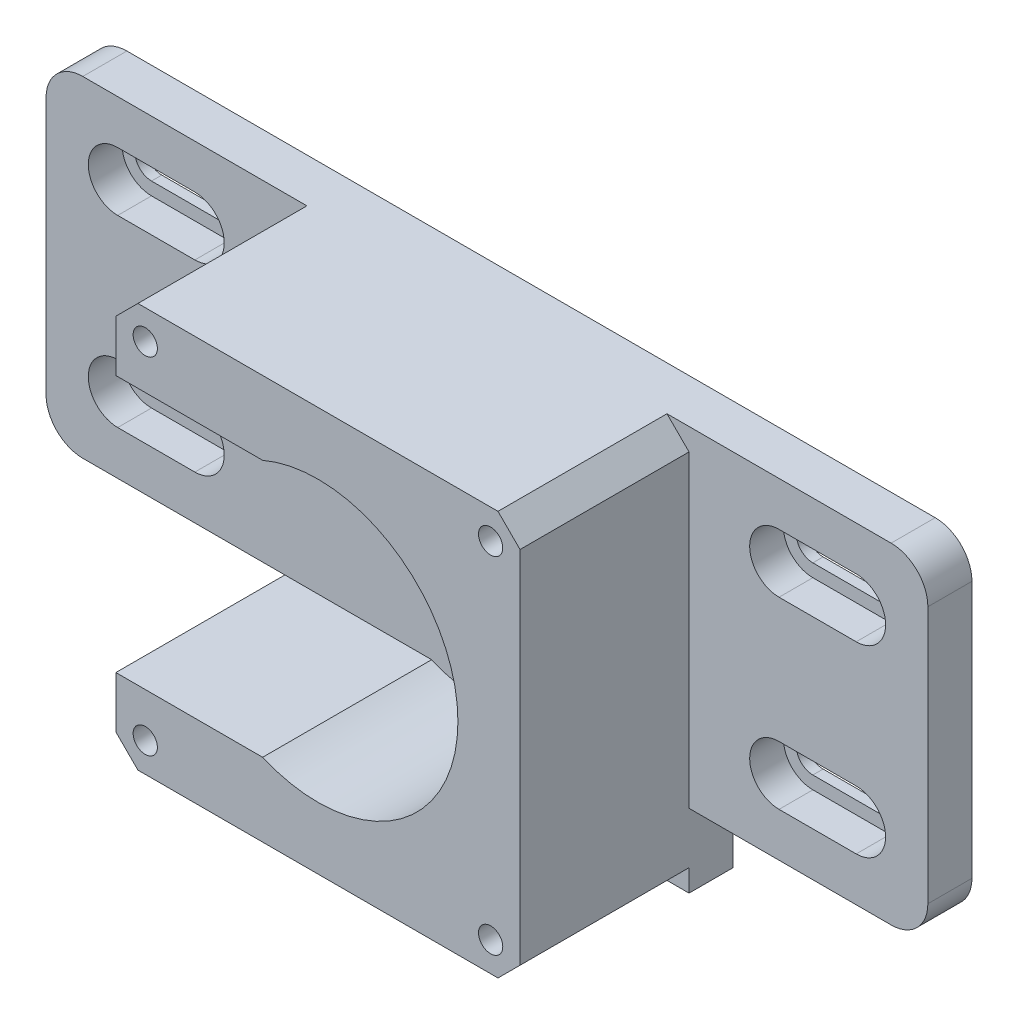
from build123d import *

# Parameters (mm, degrees)
SKETCH_1_W             = 55
SKETCH_1_H             = 55
EXTRUDE_1_DEPTH        = 14.5
SKETCH_2_R             = 19.05
CUT_EXTRUDE_1_DEPTH    = 49.512884886
SKETCH_3_W             = 40
SKETCH_3_H             = 35
CUT_EXTRUDE_2_DEPTH    = 32
CHAMFER_1_SIZE         = 3
HOLE_WIZARD_M4_1_D     = 3.3
HOLE_WIZARD_M4_1_DEPTH = 18.5
HOLE_WIZARD_M4_1_TIP   = 0.991420021
HOLE_WIZARD_M4_2_D     = 3.3
HOLE_WIZARD_M4_2_DEPTH = 18.5
HOLE_WIZARD_M4_2_TIP   = 0.991420021
SKETCH_13_W            = 120
SKETCH_13_H            = 55
EXTRUDE_2_DEPTH        = 6
SKETCH_14_W            = 32.5
SKETCH_14_H            = 10
CUT_EXTRUDE_3_DEPTH    = 10
HOLE_START             = -13.1
HOLE_WIZARD_1_DEPTH    = 4.6
HOLE_START_2           = -14.5
HOLE_WIZARD_1_2_DEPTH  = 1.4
FILLET_2_R             = 5


# Read off the part's stored shape, not the designer's step: 打孔尺寸(%根据)内六角圆柱头螺钉的类型1
with BuildPart() as part:
    # 草图1 → 凸台-拉伸1 (new, symmetric)
    with BuildSketch(Plane.XY):
        Rectangle(SKETCH_1_W, SKETCH_1_H)
    extrude(amount=EXTRUDE_1_DEPTH, both=True)

    # 草图2 → 切除-拉伸1 (cut, through all)
    with BuildSketch(Plane(origin=(0, 0, -14.5), x_dir=(-1, 0, 0), z_dir=(0, 0, -1))):
        Circle(SKETCH_2_R)
    extrude(amount=-CUT_EXTRUDE_1_DEPTH, mode=Mode.SUBTRACT)

    # 草图3 → 切除-拉伸2 (cut)
    with BuildSketch(Plane(origin=(-27.5, 0, 0), x_dir=(0, 0, -1), z_dir=(1, 0, 0))):
        Rectangle(SKETCH_3_W, SKETCH_3_H)
    extrude(amount=CUT_EXTRUDE_2_DEPTH, mode=Mode.SUBTRACT)

    # 倒角1
    chamfer_1_edges = [part.edges().sort_by_distance(p)[0] for p in [
        (27.5, -27.5, 0),
        (-27.5, -27.5, 0),
        (-27.5, 27.5, 0),
        (27.5, 27.5, 0),
    ]]
    chamfer(chamfer_1_edges, length=CHAMFER_1_SIZE)

    # M4 螺纹孔1
    with Locations(Plane(origin=(0, 0, -14.5), x_dir=(-1, 0, 0), z_dir=(0, 0, -1))):
        with Locations((-23.5, 23.5), (23.5, 23.5), (23.5, -23.5), (-23.5, -23.5)):
            Hole(HOLE_WIZARD_M4_1_D / 2, depth=HOLE_WIZARD_M4_1_DEPTH)
            with Locations((0, 0, -(HOLE_WIZARD_M4_1_DEPTH + HOLE_WIZARD_M4_1_TIP / 2))):  # 118° drill point
                Cone(0, HOLE_WIZARD_M4_1_D / 2, HOLE_WIZARD_M4_1_TIP, mode=Mode.SUBTRACT)

    # M4 螺纹孔2
    with Locations(Plane.XY.offset(14.5)):
        with Locations((23.5, 23.5), (-23.5, 23.5), (-23.5, -23.5), (23.5, -23.5)):
            Hole(HOLE_WIZARD_M4_2_D / 2, depth=HOLE_WIZARD_M4_2_DEPTH)
            with Locations((0, 0, -(HOLE_WIZARD_M4_2_DEPTH + HOLE_WIZARD_M4_2_TIP / 2))):  # 118° drill point
                Cone(0, HOLE_WIZARD_M4_2_D / 2, HOLE_WIZARD_M4_2_TIP, mode=Mode.SUBTRACT)

    # 草图13 → 凸台-拉伸2 (add)
    with BuildSketch(Plane(origin=(0, 0, -14.5), x_dir=(-1, 0, 0), z_dir=(0, 0, -1))):
        Rectangle(SKETCH_13_W, SKETCH_13_H)
    extrude(amount=-EXTRUDE_2_DEPTH)

    # 草图14 → 切除-拉伸3 (cut)
    with BuildSketch(Plane.XY.offset(-8.5)):
        with Locations((-43.75, -22.5)):
            Rectangle(SKETCH_14_W, SKETCH_14_H)
        with Locations((43.75, -22.5)):
            Rectangle(SKETCH_14_W, SKETCH_14_H)
    extrude(amount=-CUT_EXTRUDE_3_DEPTH, mode=Mode.SUBTRACT)

    # 打孔尺寸(%根据)内六角圆柱头螺钉的类型1 outline → 打孔尺寸(%根据)内六角圆柱头螺钉的类型1 (cut)
    with BuildSketch(Plane.XY.offset(HOLE_START)):
        with BuildLine():
            Line((39.75, -11.5), (50.25, -11.5))
            ThreePointArc((50.25, -11.5), (54.25, -7.5), (50.25, -3.5))
            Line((50.25, -3.5), (39.75, -3.5))
            ThreePointArc((39.75, -3.5), (35.75, -7.5), (39.75, -11.5))
        make_face()
        with BuildLine():
            ThreePointArc((-39.75, -11.5), (-35.75, -7.5), (-39.75, -3.5))
            Line((-39.75, -3.5), (-50.25, -3.5))
            ThreePointArc((-50.25, -3.5), (-54.25, -7.5), (-50.25, -11.5))
            Line((-50.25, -11.5), (-39.75, -11.5))
        make_face()
        with BuildLine():
            Line((39.75, 13.5), (50.25, 13.5))
            ThreePointArc((50.25, 13.5), (54.25, 17.5), (50.25, 21.5))
            Line((50.25, 21.5), (39.75, 21.5))
            ThreePointArc((39.75, 21.5), (35.75, 17.5), (39.75, 13.5))
        make_face()
        with BuildLine():
            ThreePointArc((-39.75, 13.5), (-35.75, 17.5), (-39.75, 21.5))
            Line((-39.75, 21.5), (-50.25, 21.5))
            ThreePointArc((-50.25, 21.5), (-54.25, 17.5), (-50.25, 13.5))
            Line((-50.25, 13.5), (-39.75, 13.5))
        make_face()
    extrude(amount=HOLE_WIZARD_1_DEPTH, mode=Mode.SUBTRACT)

    # Hole Wizard 1 2 outline → Hole Wizard 1 2 (cut)
    with BuildSketch(Plane.XY.offset(HOLE_START_2)):
        with BuildLine():
            Line((39.75, -9.75), (50.25, -9.75))
            ThreePointArc((50.25, -9.75), (52.5, -7.5), (50.25, -5.25))
            Line((50.25, -5.25), (39.75, -5.25))
            ThreePointArc((39.75, -5.25), (37.5, -7.5), (39.75, -9.75))
        make_face()
        with BuildLine():
            ThreePointArc((-39.75, -9.75), (-37.5, -7.5), (-39.75, -5.25))
            Line((-39.75, -5.25), (-50.25, -5.25))
            ThreePointArc((-50.25, -5.25), (-52.5, -7.5), (-50.25, -9.75))
            Line((-50.25, -9.75), (-39.75, -9.75))
        make_face()
        with BuildLine():
            Line((39.75, 15.25), (50.25, 15.25))
            ThreePointArc((50.25, 15.25), (52.5, 17.5), (50.25, 19.75))
            Line((50.25, 19.75), (39.75, 19.75))
            ThreePointArc((39.75, 19.75), (37.5, 17.5), (39.75, 15.25))
        make_face()
        with BuildLine():
            ThreePointArc((-39.75, 15.25), (-37.5, 17.5), (-39.75, 19.75))
            Line((-39.75, 19.75), (-50.25, 19.75))
            ThreePointArc((-50.25, 19.75), (-52.5, 17.5), (-50.25, 15.25))
            Line((-50.25, 15.25), (-39.75, 15.25))
        make_face()
    extrude(amount=HOLE_WIZARD_1_2_DEPTH, mode=Mode.SUBTRACT)

    # 圆角2
    fillet_2_edges = [part.edges().sort_by_distance(p)[0] for p in [
        (60, 27.5, -11.5),
        (-60, 27.5, -11.5),
        (-60, -17.5, -11.5),
        (60, -17.5, -11.5),
    ]]
    fillet(fillet_2_edges, radius=FILLET_2_R)


solid = part.part
